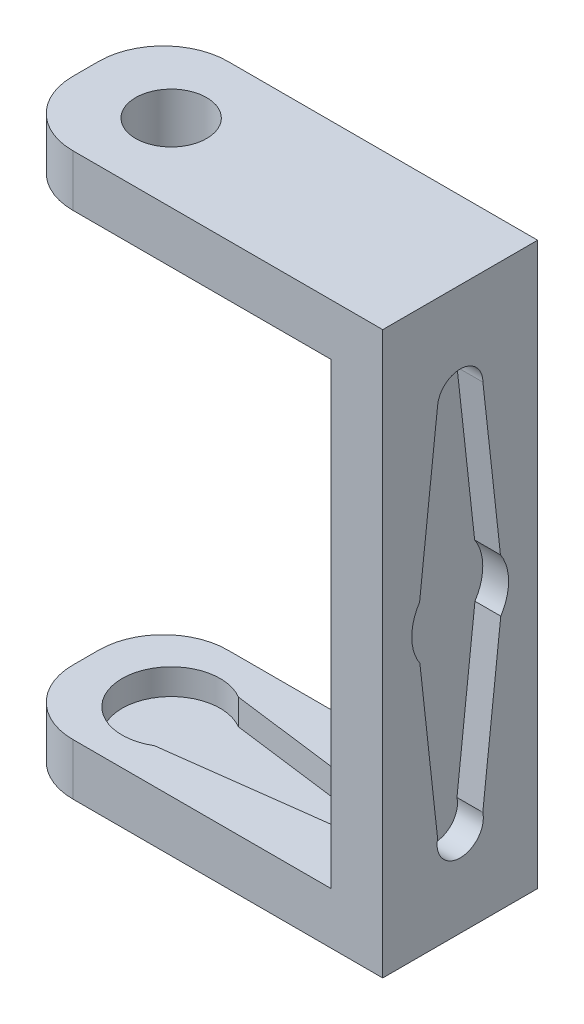
from build123d import *

# Parameters (mm, degrees)
SKETCH3_W           = 25
SKETCH3_H           = 12
BOSS_EXTRUDE1_DEPTH = 4
SINGLE_HORN_DEPTH   = 2
SKETCH4_W           = 4
SKETCH4_H           = 12
BOSS_EXTRUDE2_DEPTH = 43.5
SKETCH5_W           = 25
SKETCH5_H           = 12
BOSS_EXTRUDE4_DEPTH = 4
SKETCH6_R           = 2.75
CUT_EXTRUDE3_DEPTH  = 4
FILLET1_R           = 5
DOUBLE_HORN_DEPTH   = 2


with BuildPart() as part:
    # Sketch3 → Boss-Extrude1 (new body)
    with BuildSketch(Plane(origin=(0, 0, 0), x_dir=(1, 0, 0), z_dir=(0, 1, 0))):
        with Locations((5.890813757, 0)):
            Rectangle(SKETCH3_W, SKETCH3_H)
    extrude(amount=-BOSS_EXTRUDE1_DEPTH)

    # Sketch1 → single horn (cut)
    with BuildSketch(Plane(origin=(0, 0, 0), x_dir=(1, 0, 0), z_dir=(0, 1, 0))):
        with BuildLine():
            Line((14.242255535, 1.666957847), (1.951599523, 3.260561194))
            ThreePointArc((1.951599523, 3.260561194), (-3.8, 0), (1.951599523, -3.260561194))
            Line((1.951599523, -3.260561194), (14.242255535, -1.666957847))
            ThreePointArc((14.242255535, -1.666957847), (15.909213382, 0), (14.242255535, 1.666957847))
        make_face()
    extrude(amount=-SINGLE_HORN_DEPTH, mode=Mode.SUBTRACT)

    # Sketch4 → Boss-Extrude2 (add)
    with BuildSketch(Plane.XZ.offset(4)):
        with Locations((20.390813757, 0)):
            Rectangle(SKETCH4_W, SKETCH4_H)
    extrude(amount=-BOSS_EXTRUDE2_DEPTH)

    # Sketch5 → Boss-Extrude4 (add)
    with BuildSketch(Plane(origin=(0, 39.5, 0), x_dir=(1, 0, 0), z_dir=(0, 1, 0))):
        with Locations((5.890813757, 0)):
            Rectangle(SKETCH5_W, SKETCH5_H)
    extrude(amount=-BOSS_EXTRUDE4_DEPTH)

    # Sketch6 → Cut-Extrude3 (cut)
    with BuildSketch(Plane(origin=(0, 39.5, 0), x_dir=(1, 0, 0), z_dir=(0, 1, 0))):
        Circle(SKETCH6_R)
    extrude(amount=-CUT_EXTRUDE3_DEPTH, mode=Mode.SUBTRACT)

    # Fillet1
    fillet1_edges = [part.edges().sort_by_distance(p)[0] for p in [
        (-6.609186243, -2, -6),
        (-6.609186243, 37.5, 6),
        (-6.609186243, 37.5, -6),
        (-6.609186243, -2, 6),
    ]]
    fillet(fillet1_edges, radius=FILLET1_R)

    # Sketch11 → double horn (cut)
    with BuildSketch(Plane(origin=(22.390813757, 0, 0), x_dir=(0, 0, -1), z_dir=(1, 0, 0))):
        with BuildLine():
            Line((-1.751559478, 32.263455893), (-3.144493478, 19.793198661))
            ThreePointArc((-3.144493478, 19.793198661), (-3.749936836, 17.728234667), (-3.120564204, 15.670437775))
            Line((-3.120564204, 15.670437775), (-1.749645136, 3.233635022))
            ThreePointArc((-1.749645136, 3.233635022), (0.002766042, 1.058038152), (1.751559478, 3.236544107))
            Line((1.751559478, 3.236544107), (3.144493478, 15.706801339))
            ThreePointArc((3.144493478, 15.706801339), (3.749936836, 17.771765333), (3.120564204, 19.829562225))
            Line((3.120564204, 19.829562225), (1.759169814, 32.1))
            ThreePointArc((1.759169814, 32.1), (0.081816481, 33.8572662), (-1.751559478, 32.263455893))
        make_face()
    extrude(amount=-DOUBLE_HORN_DEPTH, mode=Mode.SUBTRACT)


solid = part.part
